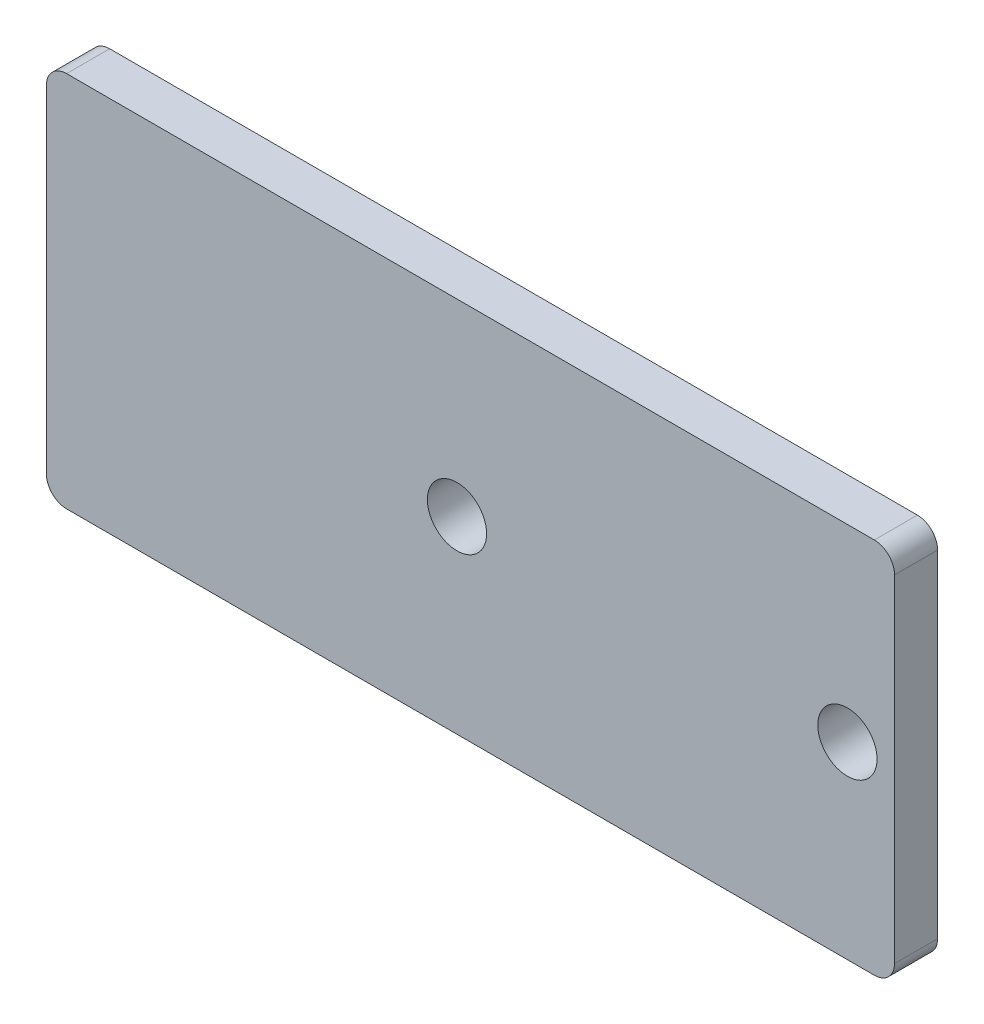
from build123d import *

# Parameters (mm, degrees)
MODEL_R             = 1.1
BOSS_EXTRUDE1_DEPTH = 0.8


with BuildPart() as part:
    # Model → Boss-Extrude1 (new, symmetric)
    with BuildSketch(Plane.XY):
        with BuildLine():
            Line((-15, -7), (15, -7))
            ThreePointArc((15, -7), (15.530330086, -6.780330086), (15.75, -6.25))
            Line((15.75, -6.25), (15.75, 6.25))
            ThreePointArc((15.75, 6.25), (15.530330086, 6.780330086), (15, 7))
            Line((15, 7), (-15, 7))
            ThreePointArc((-15, 7), (-15.530330086, 6.780330086), (-15.75, 6.25))
            Line((-15.75, 6.25), (-15.75, -6.25))
            ThreePointArc((-15.75, -6.25), (-15.530330086, -6.780330086), (-15, -7))
        make_face()
        with Locations((-0.5, 0)):
            Circle(MODEL_R, mode=Mode.SUBTRACT)
        with Locations((14, 0)):
            Circle(MODEL_R, mode=Mode.SUBTRACT)
    extrude(amount=BOSS_EXTRUDE1_DEPTH, both=True)


solid = part.part
